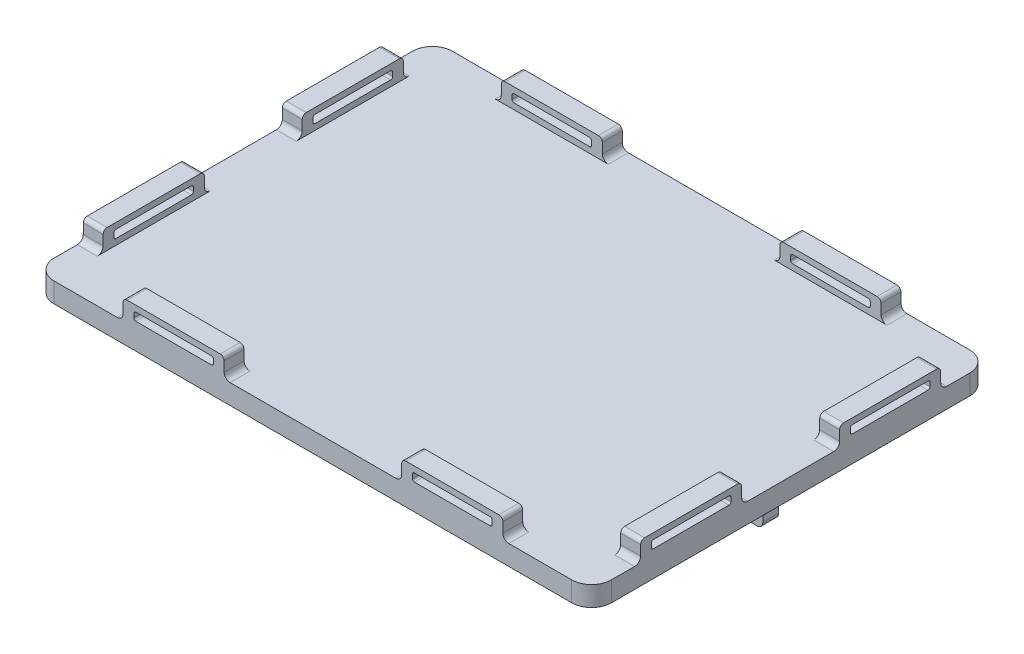
from build123d import *

# Parameters (mm, degrees)
BOSS_EXTRUDE1_DEPTH = 5
SKETCH2_W           = 4
SKETCH2_H           = 9
SKETCH2_W_2         = 9
SKETCH2_H_2         = 4
BOSS_EXTRUDE2_DEPTH = 15
SKETCH3_W           = 5
SKETCH3_H           = 25.4
SKETCH3_W_2         = 25.4
SKETCH3_H_2         = 5
BOSS_EXTRUDE3_DEPTH = 5
CUT_EXTRUDE1_DEPTH  = 173.699160392
CUT_EXTRUDE2_DEPTH  = 173.699160392
FILLET1_R           = 1
FILLET2_R           = 1.5
SKETCH6_R           = 1.55
CUT_EXTRUDE3_DEPTH  = 5
SKETCH7_R           = 1.55
CUT_EXTRUDE4_DEPTH  = 5
FILLET3_R           = 1.5
FILLET4_R           = 1.5


with BuildPart() as part:
    # Sketch1 → Boss-Extrude1 (new body)
    with BuildSketch(Plane(origin=(0, 0, 0), x_dir=(1, 0, 0), z_dir=(0, 1, 0))):
        with BuildLine():
            Line((5, 0), (135, 0))
            ThreePointArc((135, 0), (138.535533906, 1.464466094), (140, 5))
            Line((140, 5), (140, 95))
            ThreePointArc((140, 95), (138.535533906, 98.535533906), (135, 100))
            Line((135, 100), (5, 100))
            ThreePointArc((5, 100), (1.464466094, 98.535533906), (0, 95))
            Line((0, 95), (0, 5))
            ThreePointArc((0, 5), (1.464466094, 1.464466094), (5, 0))
        make_face()
    extrude(amount=BOSS_EXTRUDE1_DEPTH)

    # Sketch2 → Boss-Extrude2 (add)
    with BuildSketch(Plane.XZ):
        with Locations((14, -46.5)):
            Rectangle(SKETCH2_W, SKETCH2_H)
        with Locations((123.5, -57)):
            Rectangle(SKETCH2_W_2, SKETCH2_H_2)
    extrude(amount=BOSS_EXTRUDE2_DEPTH)

    # Sketch3 → Boss-Extrude3 (add)
    with BuildSketch(Plane(origin=(0, 5, 0), x_dir=(1, 0, 0), z_dir=(0, 1, 0))):
        with Locations((2.5, 75)):
            Rectangle(SKETCH3_W, SKETCH3_H)
        with Locations((2.5, 25)):
            Rectangle(SKETCH3_W, SKETCH3_H)
        with Locations((137.5, 75)):
            Rectangle(SKETCH3_W, SKETCH3_H)
        with Locations((137.5, 25)):
            Rectangle(SKETCH3_W, SKETCH3_H)
        with Locations((35, 97.5)):
            Rectangle(SKETCH3_W_2, SKETCH3_H_2)
        with Locations((105, 97.5)):
            Rectangle(SKETCH3_W_2, SKETCH3_H_2)
        with Locations((35, 2.5)):
            Rectangle(SKETCH3_W_2, SKETCH3_H_2)
        with Locations((105, 2.5)):
            Rectangle(SKETCH3_W_2, SKETCH3_H_2)
    extrude(amount=BOSS_EXTRUDE3_DEPTH)

    # Sketch4 → Cut-Extrude1 (cut, through all)
    with BuildSketch(Plane.ZY):
        with BuildLine():
            Line((-84.5, 8.5), (-65.5, 8.5))
            ThreePointArc((-65.5, 8.5), (-65.146446609, 8.353553391), (-65, 8))
            Line((-65, 8), (-65, 7))
            ThreePointArc((-65, 7), (-65.146446609, 6.646446609), (-65.5, 6.5))
            Line((-65.5, 6.5), (-84.5, 6.5))
            ThreePointArc((-84.5, 6.5), (-84.853553391, 6.646446609), (-85, 7))
            Line((-85, 7), (-85, 8))
            ThreePointArc((-85, 8), (-84.853553391, 8.353553391), (-84.5, 8.5))
        make_face()
        with BuildLine():
            Line((-34.5, 8.5), (-15.5, 8.5))
            ThreePointArc((-15.5, 8.5), (-15.146446609, 8.353553391), (-15, 8))
            Line((-15, 8), (-15, 7))
            ThreePointArc((-15, 7), (-15.146446609, 6.646446609), (-15.5, 6.5))
            Line((-15.5, 6.5), (-34.5, 6.5))
            ThreePointArc((-34.5, 6.5), (-34.853553391, 6.646446609), (-35, 7))
            Line((-35, 7), (-35, 8))
            ThreePointArc((-35, 8), (-34.853553391, 8.353553391), (-34.5, 8.5))
        make_face()
    extrude(amount=-CUT_EXTRUDE1_DEPTH, mode=Mode.SUBTRACT)

    # Sketch8 → Cut-Extrude2 (cut, through all)
    with BuildSketch(Plane.XY):
        with BuildLine():
            Line((25.5, 8.5), (44.5, 8.5))
            ThreePointArc((44.5, 8.5), (44.853553391, 8.353553391), (45, 8))
            Line((45, 8), (45, 7))
            ThreePointArc((45, 7), (44.853553391, 6.646446609), (44.5, 6.5))
            Line((44.5, 6.5), (25.5, 6.5))
            ThreePointArc((25.5, 6.5), (25.146446609, 6.646446609), (25, 7))
            Line((25, 7), (25, 8))
            ThreePointArc((25, 8), (25.146446609, 8.353553391), (25.5, 8.5))
        make_face()
        with BuildLine():
            Line((95.5, 8.5), (114.5, 8.5))
            ThreePointArc((114.5, 8.5), (114.853553391, 8.353553391), (115, 8))
            Line((115, 8), (115, 7))
            ThreePointArc((115, 7), (114.853553391, 6.646446609), (114.5, 6.5))
            Line((114.5, 6.5), (95.5, 6.5))
            ThreePointArc((95.5, 6.5), (95.146446609, 6.646446609), (95, 7))
            Line((95, 7), (95, 8))
            ThreePointArc((95, 8), (95.146446609, 8.353553391), (95.5, 8.5))
        make_face()
    extrude(amount=-CUT_EXTRUDE2_DEPTH, mode=Mode.SUBTRACT)

    # Fillet1
    fillet1_edges = [part.edges().sort_by_distance(p)[0] for p in [
        (137.5, 10, -87.7),
        (137.5, 10, -62.3),
        (2.5, 10, -62.3),
        (2.5, 10, -87.7),
        (22.3, 10, -97.5),
        (47.7, 10, -97.5),
        (137.5, 10, -37.7),
        (137.5, 10, -12.3),
        (2.5, 10, -37.7),
        (2.5, 10, -12.3),
        (117.7, 10, -97.5),
        (92.3, 10, -97.5),
        (117.7, 10, -2.5),
        (92.3, 10, -2.5),
        (47.7, 10, -2.5),
        (22.3, 10, -2.5),
    ]]
    fillet(fillet1_edges, radius=FILLET1_R)

    # Fillet2
    fillet2_edges = [part.edges().sort_by_distance(p)[0] for p in [
        (22.3, 5, -97.5),
        (47.7, 5, -97.5),
        (137.5, 5, -62.3),
        (137.5, 5, -87.7),
        (2.5, 5, -87.7),
        (2.5, 5, -62.3),
        (137.5, 5, -37.7),
        (137.5, 5, -12.3),
        (2.5, 5, -37.7),
        (2.5, 5, -12.3),
        (117.7, 5, -97.5),
        (92.3, 5, -97.5),
        (117.7, 5, -2.5),
        (92.3, 5, -2.5),
        (47.7, 5, -2.5),
        (22.3, 5, -2.5),
    ]]
    fillet(fillet2_edges, radius=FILLET2_R)

    # Sketch6 → Cut-Extrude3 (cut)
    with BuildSketch(Plane.ZY.offset(-12)):
        with Locations((-46.5, -11)):
            Circle(SKETCH6_R)
    extrude(amount=-CUT_EXTRUDE3_DEPTH, mode=Mode.SUBTRACT)

    # Sketch7 → Cut-Extrude4 (cut)
    with BuildSketch(Plane.XY.offset(-55)):
        with Locations((123.5, -11)):
            Circle(SKETCH7_R)
    extrude(amount=-CUT_EXTRUDE4_DEPTH, mode=Mode.SUBTRACT)

    # Fillet3
    fillet3_edges = [part.edges().sort_by_distance(p)[0] for p in [
        (128, -15, -57),
        (119, -15, -57),
        (14, -15, -42),
        (14, -15, -51),
    ]]
    fillet(fillet3_edges, radius=FILLET3_R)

    # Fillet4
    fillet4_edges = [part.edges().sort_by_distance(p)[0] for p in [
        (128, 0, -57),
        (119, 0, -57),
        (14, 0, -42),
        (14, 0, -51),
    ]]
    fillet(fillet4_edges, radius=FILLET4_R)


solid = part.part
